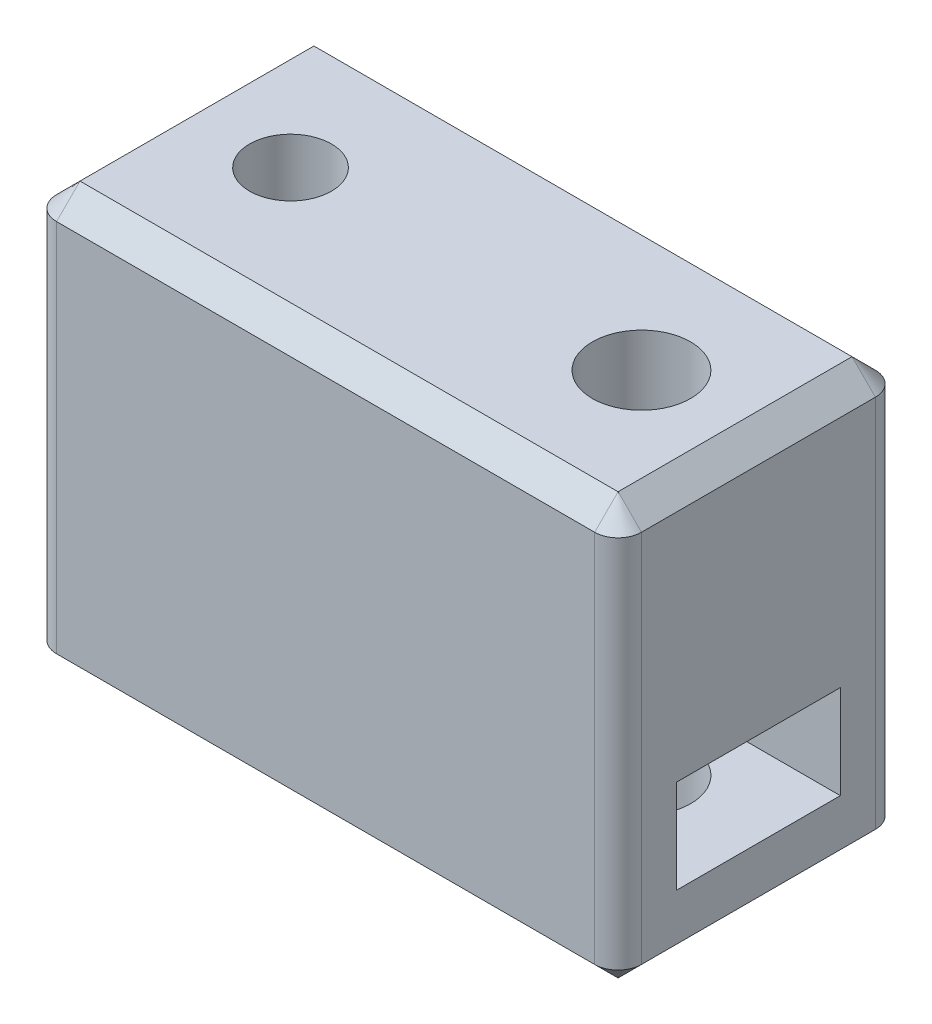
from build123d import *

# Parameters (mm, degrees)
SKETCH2_W           = 25
SKETCH2_H           = 12
SKETCH2_R           = 1.75
SKETCH2_R_2         = 2.1
BOSS_EXTRUDE1_DEPTH = 18
SKETCH7_W           = 7
SKETCH7_H           = 4
CUT_EXTRUDE3_DEPTH  = 10
SKETCH9_W           = 5.5
SKETCH9_H           = 3
CUT_EXTRUDE4_DEPTH  = 8
FILLET1_R           = 1
CHAMFER1_SIZE       = 1


with BuildPart() as part:
    # Sketch2 → Boss-Extrude1 (new body)
    with BuildSketch(Plane(origin=(0, 0, 0), x_dir=(1, 0, 0), z_dir=(0, 1, 0))):
        Rectangle(SKETCH2_W, SKETCH2_H)
        with Locations((-7.5, 0)):
            Circle(SKETCH2_R, mode=Mode.SUBTRACT)
        with Locations((7.5, 0)):
            Circle(SKETCH2_R_2, mode=Mode.SUBTRACT)
    extrude(amount=BOSS_EXTRUDE1_DEPTH)

    # Sketch7 → Cut-Extrude3 (cut)
    with BuildSketch(Plane(origin=(12.5, 0, 0), x_dir=(0, 0, -1), z_dir=(1, 0, 0))):
        with Locations((0, 5)):
            Rectangle(SKETCH7_W, SKETCH7_H)
    extrude(amount=-CUT_EXTRUDE3_DEPTH, mode=Mode.SUBTRACT)

    # Sketch9 → Cut-Extrude4 (cut)
    with BuildSketch(Plane.ZY.offset(12.5)):
        with Locations((0, 4.5)):
            Rectangle(SKETCH9_W, SKETCH9_H)
    extrude(amount=-CUT_EXTRUDE4_DEPTH, mode=Mode.SUBTRACT)

    # Fillet1
    fillet1_edges = [part.edges().sort_by_distance(p)[0] for p in [
        (-12.5, 9, 6),
        (-12.5, 9, -6),
        (12.5, 9, -6),
        (12.5, 9, 6),
    ]]
    fillet(fillet1_edges, radius=FILLET1_R)

    # Chamfer1
    chamfer1_edges = [part.edges().sort_by_distance(p)[0] for p in [
        (0, 0, -6),
        (-12.207106781, 0, -5.707106781),
        (12.207106781, 0, -5.707106781),
        (-12.5, 0, 0),
        (12.5, 0, 0),
        (-12.207106781, 0, 5.707106781),
        (12.207106781, 0, 5.707106781),
        (0, 0, 6),
        (0, 18, -6),
        (-12.207106781, 18, -5.707106781),
        (12.207106781, 18, -5.707106781),
        (-12.5, 18, 0),
        (12.5, 18, 0),
        (-12.207106781, 18, 5.707106781),
        (12.207106781, 18, 5.707106781),
        (0, 18, 6),
    ]]
    chamfer(chamfer1_edges, length=CHAMFER1_SIZE)


solid = part.part
